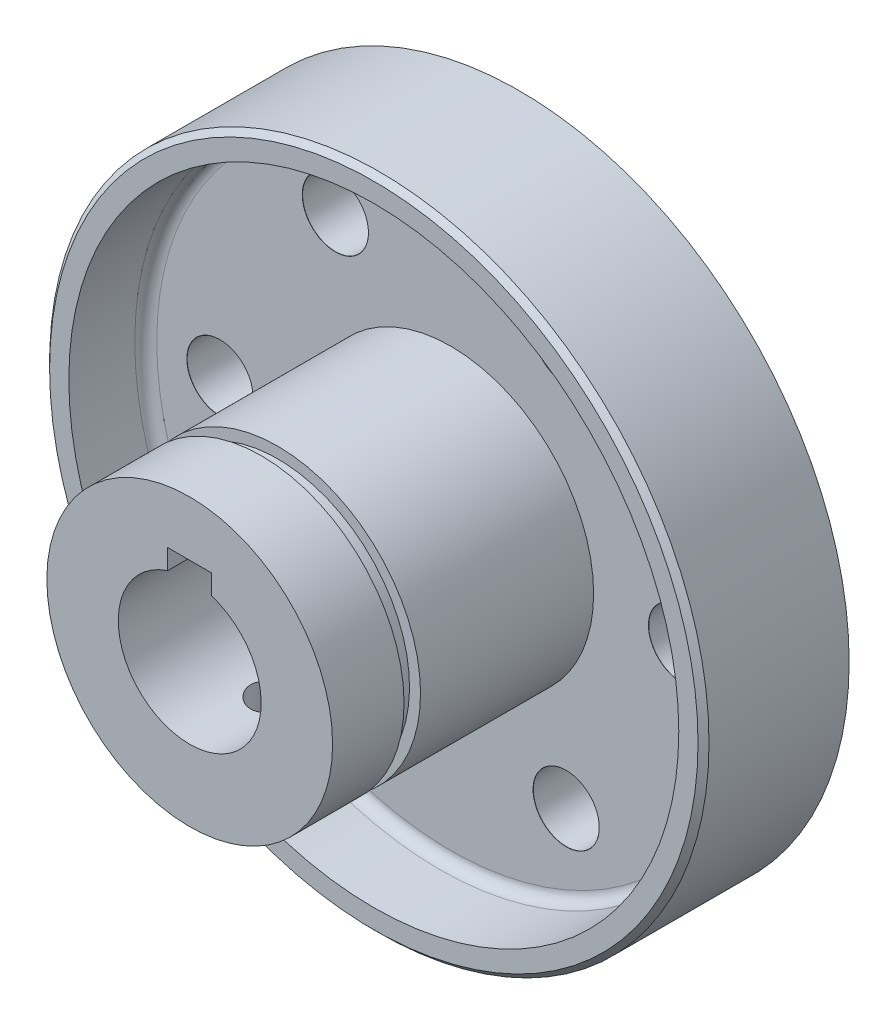
from build123d import *

# Parameters (mm, degrees)
SKETCH_1_R                        = 60
EXTRUDE_1_DEPTH                   = 26.5
SKETCH_2_R                        = 26
EXTRUDE_2_DEPTH                   = 60
CUT_EXTRUDE_START                 = -14
SKETCH_3_R                        = 55.5
SKETCH_3_R_2                      = 26
CUT_EXTRUDE_1_DEPTH               = 14
CUT_EXTRUDE_2_DEPTH               = 104.923048454
CUT_EXTRUDE_START_2               = -16
SKETCH_5_R                        = 26
SKETCH_5_R_2                      = 24
CUT_EXTRUDE_3_DEPTH               = 3
HOLE_WIZARD_12_0_12_1_D           = 12
HOLE_WIZARD_12_0_12_1_CSINK_D     = 12.05
HOLE_WIZARD_12_0_12_1_CSINK_ANGLE = 90
CHAMFER_1_SIZE                    = 1
FILLET_1_R                        = 2


# Read off the part's stored shape, not the designer's step: M8 螺纹孔的螺纹孔钻头1
with BuildPart() as part:
    # 草图1 → 凸台-拉伸1 (new body)
    with BuildSketch(Plane.XY):
        Circle(SKETCH_1_R)
    extrude(amount=EXTRUDE_1_DEPTH)

    # 草图2 → 凸台-拉伸2 (add)
    with BuildSketch(Plane.XY):
        Circle(SKETCH_2_R)
    extrude(amount=EXTRUDE_2_DEPTH)

    # 草图3 → 切除-拉伸1 (cut)
    with BuildSketch(Plane.XY.offset(26.5).offset(CUT_EXTRUDE_START)):
        Circle(SKETCH_3_R)
        Circle(SKETCH_3_R_2, mode=Mode.SUBTRACT)
    extrude(amount=CUT_EXTRUDE_1_DEPTH, mode=Mode.SUBTRACT)

    # 草图4 → 切除-拉伸2 (cut, through all)
    with BuildSketch(Plane.XY.offset(60)):
        with BuildLine():
            Line((-4, 12.369316877), (-4, 16))
            Line((-4, 16), (4, 16))
            Line((4, 16), (4, 12.369316877))
            ThreePointArc((4, 12.369316877), (0, -13), (-4, 12.369316877))
        make_face()
    extrude(amount=-CUT_EXTRUDE_2_DEPTH, mode=Mode.SUBTRACT)

    # M8 螺纹孔的螺纹孔钻头1 outline → M8 螺纹孔的螺纹孔钻头1 (revolve, cut)
    with BuildSketch(Plane.XY.offset(45.5)):
        Polygon((0, -26.000014008), (3.425014008, -26.000014008), (3.399999801, -25.974999801), (3.4, -12.54744384), (0, -12.54744384), align=None)
    revolve(axis=Axis((0, 0, 45.5), (0, 1, 0)), mode=Mode.SUBTRACT)

    # 草图5 → 切除-拉伸3 (cut)
    with BuildSketch(Plane.XY.offset(60).offset(CUT_EXTRUDE_START_2)):
        with Locations(Location((0, 0, 0), (0, 0, 263.260542122))):
            Circle(SKETCH_5_R)
        Circle(SKETCH_5_R_2, mode=Mode.SUBTRACT)
    extrude(amount=CUT_EXTRUDE_3_DEPTH, mode=Mode.SUBTRACT)

    # Ø12.0 (12) 直径孔1 (through all)
    with Locations(Plane.XY.offset(12.5)):
        with Locations((21, 36.373066959), (42, 0), (21, -36.373066959), (-21, -36.373066959), (-42, 0), (-21, 36.373066959)):
            CounterSinkHole(HOLE_WIZARD_12_0_12_1_D / 2, HOLE_WIZARD_12_0_12_1_CSINK_D / 2, counter_sink_angle=HOLE_WIZARD_12_0_12_1_CSINK_ANGLE)

    # 倒角1
    chamfer_1_edges = [part.edges().sort_by_distance(p)[0] for p in [
        (-60, 0, 26.5),
    ]]
    chamfer(chamfer_1_edges, length=CHAMFER_1_SIZE)

    # 圆角1
    fillet_1_edges = [part.edges().sort_by_distance(p)[0] for p in [
        (-55.5, 0, 12.5),
    ]]
    fillet(fillet_1_edges, radius=FILLET_1_R)


solid = part.part
